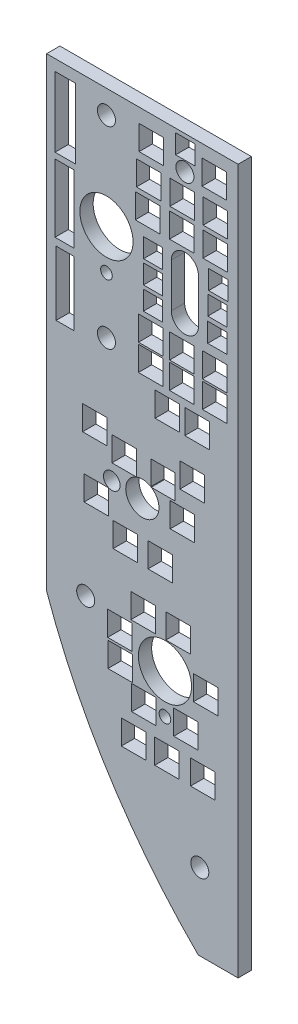
from build123d import *

# Parameters (mm, degrees)
BOSS_EXTRUDE1_DEPTH             = 3.175
F_1_2_0_5_DIAMETER_HOLE1_D      = 12.7
F_5_16_0_3125_DIAMETER_HOLE1_D  = 7.9375
F_5_32_0_15625_DIAMETER_HOLE1_D = 3.96875
F_7_64_0_10938_DIAMETER_HOLE1_D = 2.778252
F_6_CLEARANCE_HOLE1_D           = 4.3053
F_16_0_177_DIAMETER_HOLE1_D     = 4.4958
SKETCH16_W                      = 5.842
SKETCH16_H                      = 5.842
SKETCH16_W_2                    = 4.23392063
SKETCH16_H_2                    = 15.366349947
SKETCH16_W_3                    = 4.5021552
SKETCH16_H_3                    = 16.206338068
SKETCH16_W_4                    = 4.860523654
SKETCH16_H_4                    = 16.706116904
SKETCH16_W_5                    = 4.572
SKETCH16_H_5                    = 4.572
CUT_EXTRUDE5_DEPTH              = 149.577510685


with BuildPart() as part:
    # Sketch1 → Boss-Extrude1 (new body)
    with BuildSketch(Plane.XY):
        with BuildLine():
            Line((-45.72, 26.9875), (-45.72, -84.1375))
            ThreePointArc((-45.72, -84.1375), (-30.833523511, -114.746148224), (-9.525, -141.2875))
            Line((-9.525, -141.2875), (0, -141.2875))
            Line((0, -141.2875), (0, 26.9875))
            Line((0, 26.9875), (-45.72, 26.9875))
        make_face()
    extrude(amount=-BOSS_EXTRUDE1_DEPTH)

    # 1/2 (0.5) Diameter Hole1 (through all)
    with Locations(Plane.XY):
        with Locations((-17.4625, -86.5505), (-31.4325, -1.620345612)):
            Hole(F_1_2_0_5_DIAMETER_HOLE1_D / 2)

    # 5/16 (0.3125) Diameter Hole1 (through all)
    with Locations(Plane.XY):
        with Locations((-22.86, -53.5305)):
            Hole(F_5_16_0_3125_DIAMETER_HOLE1_D / 2)

    # 5/32 (0.15625) Diameter Hole1 (through all)
    with Locations(Plane.XY):
        with Locations((-30.161117219, -53.5305)):
            Hole(F_5_32_0_15625_DIAMETER_HOLE1_D / 2)

    # 7/64 (0.10938) Diameter Hole1 (through all)
    with Locations(Plane.XY):
        with Locations((-17.464635625, -95.966719242), (-31.4325, -11.158858051)):
            Hole(F_7_64_0_10938_DIAMETER_HOLE1_D / 2)

    # #6 Clearance Hole1 (through all)
    with Locations(Plane(origin=(0, 0, -3.175), x_dir=(-1, 0, 0), z_dir=(0, 0, -1))):
        with Locations((12.7, 19.05), (36.3855, -80.4545), (9.144, -122.9995), (31.4325, -24.620045612), (31.4325, 21.404754388)):
            Hole(F_6_CLEARANCE_HOLE1_D / 2)

    # #16 (0.177) Diameter Hole1 (through all)
    with Locations(Plane(origin=(0, 0, -3.175), x_dir=(-1, 0, 0), z_dir=(0, 0, -1))):
        with Locations((12.7, -0.780389216), (12.7, -11.284610784)):
            Hole(F_16_0_177_DIAMETER_HOLE1_D / 2)

    # Sketch16 → Cut-Extrude5 (cut, through all)
    with BuildSketch(Plane(origin=(0, 0, -4.775), x_dir=(-1, 0, 0), z_dir=(0, 0, -1))):
        with Locations((5.586877071, -25.056435986)):
            Rectangle(SKETCH16_W, SKETCH16_H)
        with Locations((13.472877071, -25.056435995)):
            Rectangle(SKETCH16_W, SKETCH16_H)
        with Locations((20.877877071, -25.056436004)):
            Rectangle(SKETCH16_W, SKETCH16_H)
        with Locations((20.852877078, -18.782436004)):
            Rectangle(SKETCH16_W, SKETCH16_H)
        with Locations((13.435877078, -18.757435995)):
            Rectangle(SKETCH16_W, SKETCH16_H)
        with Locations((5.612877078, -18.732435986)):
            Rectangle(SKETCH16_W, SKETCH16_H)
        with Locations((41.333495216, -19.347538251)):
            Rectangle(SKETCH16_W_2, SKETCH16_H_2)
        with Locations((41.467612501, -1.87219716)):
            Rectangle(SKETCH16_W_3, SKETCH16_H_3)
        with Locations((41.288428274, 15.966538328)):
            Rectangle(SKETCH16_W_4, SKETCH16_H_4)
        with Locations((9.803877062, -32.575435991)):
            Rectangle(SKETCH16_W, SKETCH16_H)
        with Locations((16.889877062, -32.524435999)):
            Rectangle(SKETCH16_W, SKETCH16_H)
        with Locations((8.429876979, -104.35563599)):
            Rectangle(SKETCH16_W, SKETCH16_H)
        with Locations((16.989876979, -104.329835999)):
            Rectangle(SKETCH16_W, SKETCH16_H)
        with Locations((24.967876979, -104.355236009)):
            Rectangle(SKETCH16_W, SKETCH16_H)
        with Locations((12.444876989, -96.049835994)):
            Rectangle(SKETCH16_W, SKETCH16_H)
        with Locations((22.477876989, -95.998636006)):
            Rectangle(SKETCH16_W, SKETCH16_H)
        with Locations((7.745877, -86.575635989)):
            Rectangle(SKETCH16_W, SKETCH16_H)
        with Locations((28.153876996, -89.902836012)):
            Rectangle(SKETCH16_W, SKETCH16_H)
        with Locations((28.216877004, -83.501836012)):
            Rectangle(SKETCH16_W, SKETCH16_H)
        with Locations((22.681877011, -77.075636006)):
            Rectangle(SKETCH16_W, SKETCH16_H)
        with Locations((14.322877011, -77.101435996)):
            Rectangle(SKETCH16_W, SKETCH16_H)
        with Locations((18.591877025, -64.528436001)):
            Rectangle(SKETCH16_W, SKETCH16_H)
        with Locations((26.922877025, -64.503036011)):
            Rectangle(SKETCH16_W, SKETCH16_H)
        with Locations((33.857877033, -58.330836019)):
            Rectangle(SKETCH16_W, SKETCH16_H)
        with Locations((13.280877038, -53.581035995)):
            Rectangle(SKETCH16_W, SKETCH16_H)
        with Locations((10.971877049, -44.208435993)):
            Rectangle(SKETCH16_W, SKETCH16_H)
        with Locations((17.931877045, -47.256436001)):
            Rectangle(SKETCH16_W, SKETCH16_H)
        with Locations((27.202877046, -46.900836011)):
            Rectangle(SKETCH16_W, SKETCH16_H)
        with Locations((34.212877049, -43.979836019)):
            Rectangle(SKETCH16_W, SKETCH16_H)
        with BuildLine():
            Line((9.460927119, -11.284610784), (9.460927119, -0.780389216))
            ThreePointArc((9.460927119, -0.780389216), (12.7, 2.458683665), (15.939072881, -0.780389216))
            Line((15.939072881, -0.780389216), (15.939072881, -11.284610784))
            ThreePointArc((15.939072881, -11.284610784), (12.7, -14.523683665), (9.460927119, -11.284610784))
        make_face()
        with Locations((4.966877087, -11.380435986)):
            Rectangle(SKETCH16_W_5, SKETCH16_H_5)
        with Locations((4.951877093, -5.752435986)):
            Rectangle(SKETCH16_W_5, SKETCH16_H_5)
        with Locations((4.746877099, -0.368435985)):
            Rectangle(SKETCH16_W_5, SKETCH16_H_5)
        with Locations((5.459877107, 6.286564014)):
            Rectangle(SKETCH16_W, SKETCH16_H)
        with Locations((13.458877107, 6.235564005)):
            Rectangle(SKETCH16_W, SKETCH16_H)
        with Locations((21.625877107, 6.134563995)):
            Rectangle(SKETCH16_W, SKETCH16_H)
        with Locations((20.282877098, -1.550436003)):
            Rectangle(SKETCH16_W_5, SKETCH16_H_5)
        with Locations((20.307877092, -6.985436003)):
            Rectangle(SKETCH16_W_5, SKETCH16_H_5)
        with Locations((20.333877086, -12.421436003)):
            Rectangle(SKETCH16_W_5, SKETCH16_H_5)
        with Locations((5.406877115, 13.145564014)):
            Rectangle(SKETCH16_W, SKETCH16_H)
        with Locations((13.359877115, 13.068564005)):
            Rectangle(SKETCH16_W, SKETCH16_H)
        with Locations((21.360877115, 13.068563996)):
            Rectangle(SKETCH16_W, SKETCH16_H)
        with Locations((20.725877124, 20.688563996)):
            Rectangle(SKETCH16_W, SKETCH16_H)
        with Locations((5.686877124, 21.069564014)):
            Rectangle(SKETCH16_W, SKETCH16_H)
        with Locations((12.622877127, 23.761564006)):
            Rectangle(SKETCH16_W_5, SKETCH16_H_5)
    extrude(amount=-CUT_EXTRUDE5_DEPTH, mode=Mode.SUBTRACT)


solid = part.part
